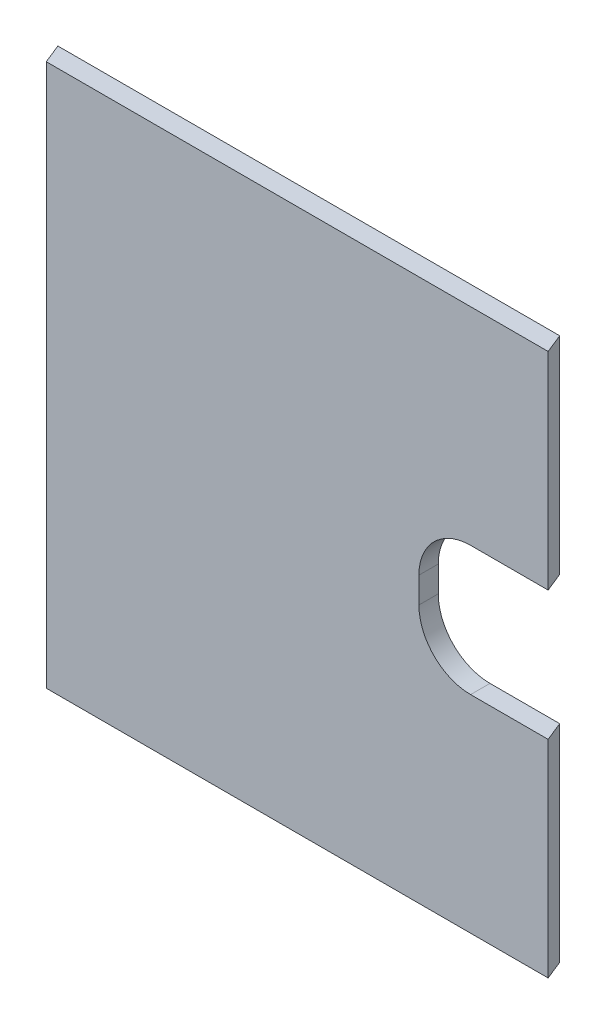
from build123d import *

# Parameters (mm, degrees)
SKETCH1_W           = 493.106084352
SKETCH1_H           = 533.146
BOSS_EXTRUDE1_DEPTH = 19.05
BOSS_EXTRUDE3_DEPTH = 533.146
CUT_EXTRUDE1_DEPTH  = 5496.210802379
SKETCH5_W           = 127
SKETCH5_H           = 127
CUT_EXTRUDE2_DEPTH  = 5496.210802379
FILLET1_R           = 50.8


with BuildPart() as part:
    # Sketch1 → Boss-Extrude1 (new body)
    with BuildSketch(Plane.XY):
        with Locations((-5222.700490325, 266.573)):
            Rectangle(SKETCH1_W, SKETCH1_H)
    extrude(amount=BOSS_EXTRUDE1_DEPTH)

    # Boss-Extrude3: read off the stored shape, not the designer's step
    # Boss-Extrude3 outline → Boss-Extrude3 (add)
    with BuildSketch(Plane(origin=(0, 0, 0), x_dir=(1, 0, 0), z_dir=(0, 1, 0))):
        Polygon((-4976.147448149, -19.05), (-4968.450748546, -19.05), (-4976.147448148, 0), align=None)
    extrude(amount=BOSS_EXTRUDE3_DEPTH)

    # Sketch2 → Cut-Extrude1 (cut, through all)
    with BuildSketch(Plane(origin=(0, 533.146, 0), x_dir=(1, 0, 0), z_dir=(0, 1, 0))):
        Polygon((-5469.253532501, 0), (-5461.556832899, -19.05), (-5469.253532501, -19.05), align=None)
    extrude(amount=-CUT_EXTRUDE1_DEPTH, mode=Mode.SUBTRACT)

    # Sketch5 → Cut-Extrude2 (cut, through all)
    with BuildSketch(Plane.XY.offset(19.05)):
        with Locations((-5031.950748546, 266.573)):
            Rectangle(SKETCH5_W, SKETCH5_H)
    extrude(amount=-CUT_EXTRUDE2_DEPTH, mode=Mode.SUBTRACT)

    # Fillet1
    fillet1_edges = [part.edges().sort_by_distance(p)[0] for p in [
        (-5095.450748546, 330.073, 9.525),
        (-5095.450748546, 203.073, 9.525),
    ]]
    fillet(fillet1_edges, radius=FILLET1_R)


solid = part.part
